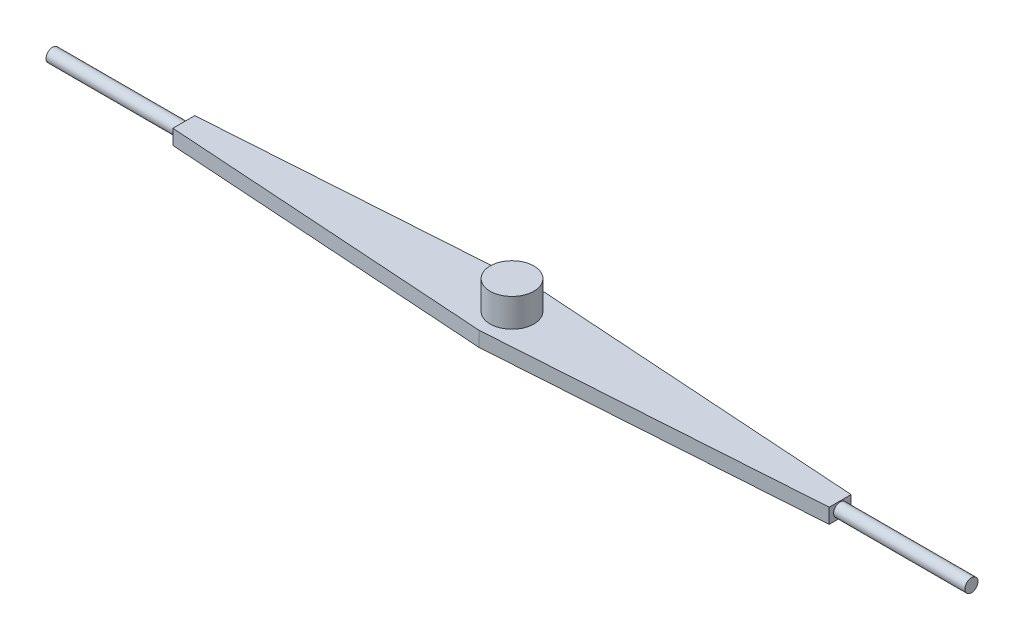
from build123d import *

# Parameters (mm, degrees)
SKETCH2_R                = 10
BASE_FLANGE1_DEPTH       = 6.8
SKETCH7_R                = 3
BASE_FLANGE3_DEPTH       = 60
SKETCH14_R               = 3
BASE_FLANGE4_DEPTH       = 60
BOSS_EXTRUDE1_DEPTH      = 13
BOSS_EXTRUDE1_DEPTH_BACK = 9.8


# Sheet-metal steps are written as plain solids
with BuildPart() as part:
    # Sketch2 → Base-Flange1 (new body)
    with BuildSketch(Plane(origin=(0, 0, 0), x_dir=(1, 0, 0), z_dir=(0, 1, 0))):
        Polygon((0, 0), (0, 10), (150, 20), (300, 10), (300, 0), (150, -10), align=None)
        with Locations(Location((150, 5, 0), (0, 0, 270))):
            Circle(SKETCH2_R, mode=Mode.SUBTRACT)
    extrude(amount=-BASE_FLANGE1_DEPTH)

    # Sketch2<2> → Boss-Extrude1 (add, two sides: drawn at the far end of the back side and taken through both)
    with BuildSketch(Plane(origin=(0, 0, 0), x_dir=(1, 0, 0), z_dir=(0, 1, 0)).offset(-BOSS_EXTRUDE1_DEPTH_BACK)):
        with BuildLine():
            ThreePointArc((150, 15), (140, 5), (150, -5))
            Line((150, -5), (150, 15))
        make_face()
        with BuildLine():
            Line((150, 15), (150, -5))
            ThreePointArc((150, -5), (157.071067812, -2.071067812), (160, 5))
            ThreePointArc((160, 5), (157.071067812, 12.071067812), (150, 15))
        make_face()
    extrude(amount=BOSS_EXTRUDE1_DEPTH + BOSS_EXTRUDE1_DEPTH_BACK)


with BuildPart() as body_2:
    # Sketch7 → Base-Flange3 (new body)
    with BuildSketch(Plane.ZY):
        with Locations((-5, -3.4)):
            Circle(SKETCH7_R)
    extrude(amount=BASE_FLANGE3_DEPTH)


with BuildPart() as body_3:
    # Sketch14 → Base-Flange4 (new body)
    with BuildSketch(Plane(origin=(300, 0, 0), x_dir=(0, 0, -1), z_dir=(1, 0, 0))):
        with Locations((5, -3.4)):
            Circle(SKETCH14_R)
    extrude(amount=BASE_FLANGE4_DEPTH)


solid = Compound([part.part, body_2.part, body_3.part])
